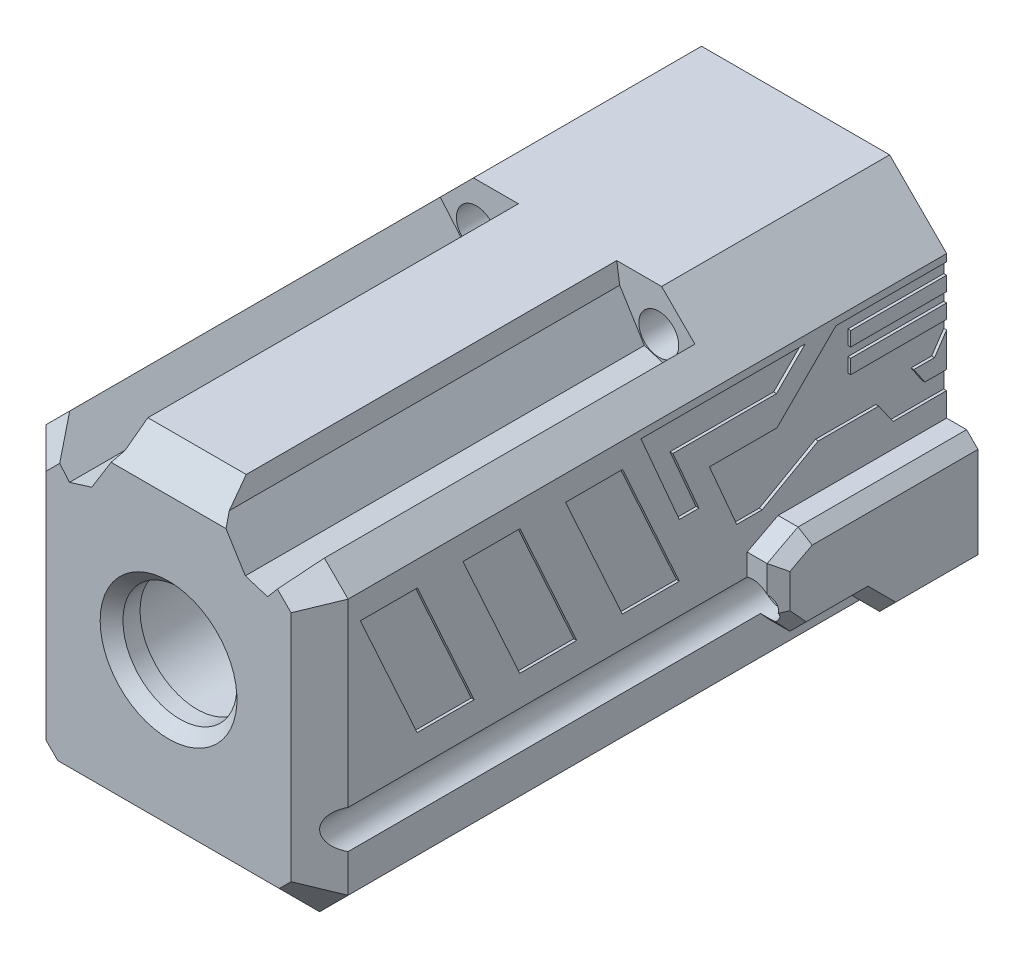
from build123d import *

# Parameters (mm, degrees)
EXTRUDE_1_DEPTH            = 26.5
CUT_EXTRUDE_1_DEPTH        = 20
CUT_EXTRUDE_4_DEPTH        = 22.6
SKETCH_7_W                 = 9.3
SKETCH_7_H                 = 6.5
EXTRUDE_2_DEPTH            = 23
CHAMFER_1_SIZE             = 2.5
CHAMFER_2_SIZE             = 10
SKETCH_8_R                 = 3.025
CUT_EXTRUDE_5_DEPTH        = 6
CHAMFER_3_SIZE             = 5
EXTRUDE_3_DEPTH            = 20
SKETCH_10_R                = 11.1
CUT_EXTRUDE_6_DEPTH        = 85
SKETCH_3_R                 = 10
CUT_EXTRUDE_7_DEPTH        = 129.071269221
CHAMFER_4_SIZE             = 2
EXTRUDE_4_DEPTH            = 5.5
CHAMFER_5_SIZE             = 2
CHAMFER_5_OF_MIRROR_1_SIZE = 2
SKETCH_14_R                = 1.95
CUT_EXTRUDE_8_DEPTH        = 130.321305283
SKETCH_15_R                = 3.5
CUT_EXTRUDE_9_DEPTH        = 80
CHAMFER_6_SIZE             = 5
CUT_EXTRUDE_10_DEPTH       = 70
CUT_EXTRUDE_11_REACH       = 131.321
CUT_EXTRUDE_11_END_RADIUS  = 11.1
SKETCH_17_R                = 1.925
SKETCH_18_R                = 3.5
CUT_EXTRUDE_12_DEPTH       = 4
CUT_EXTRUDE_13_DEPTH       = 0.5
CHAMFER_7_SIZE             = 0.3


with BuildPart() as part:
    # 스케치1 → 보스-돌출1 (new, symmetric)
    with BuildSketch(Plane(origin=(0, 0, 0), x_dir=(0, 0, -1), z_dir=(1, 0, 0))):
        Polygon((0, 0), (0, -55), (-24.02707612, -55), (-26.365643229, -60), (-110, -60), (-110, 0), align=None)
    extrude(amount=EXTRUDE_1_DEPTH, both=True)

    # 스케치2 → 컷-돌출1 (cut)
    with BuildSketch(Plane.XY):
        with BuildLine():
            Line((22.575, -30), (22.575, -55))
            Line((22.575, -55), (-22.575, -55))
            Line((-22.575, -55), (-22.575, -30))
            ThreePointArc((-22.575, -30), (0, -7.425), (22.575, -30))
        make_face()
    extrude(amount=CUT_EXTRUDE_1_DEPTH, mode=Mode.SUBTRACT)

    # 스케치6 → 컷-돌출4 (cut, symmetric)
    with BuildSketch(Plane(origin=(0, 0, 0), x_dir=(0, 0, -1), z_dir=(1, 0, 0))):
        Polygon((-20, -46.112161055), (-23.199788804, -55), (-20, -55), align=None)
    extrude(amount=CUT_EXTRUDE_4_DEPTH, both=True, mode=Mode.SUBTRACT)

    # 스케치7 → 보스-돌출2 (add, symmetric)
    with BuildSketch(Plane(origin=(0, 0, 0), x_dir=(0, 0, -1), z_dir=(1, 0, 0))):
        with Locations((-15.35, -43.25)):
            Rectangle(SKETCH_7_W, SKETCH_7_H)
    extrude(amount=EXTRUDE_2_DEPTH, both=True)

    # 모따기1
    chamfer_1_edges = [part.edges().sort_by_distance(p)[0] for p in [
        (0, -46.5, 10.7),
        (0, -40, 10.7),
    ]]
    chamfer(chamfer_1_edges, length=CHAMFER_1_SIZE)

    # 모따기2
    chamfer_2_edges = [part.edges().sort_by_distance(p)[0] for p in [
        (26.5, 0, 55),
        (-26.5, 0, 55),
    ]]
    chamfer(chamfer_2_edges, length=CHAMFER_2_SIZE)

    # 스케치8 → 컷-돌출5 (cut)
    with BuildSketch(Plane(origin=(0, 1.083216677, 3.008778377), x_dir=(-1, 0, 0), z_dir=(0, -0.3387350985507473, -0.9408817848219911))):
        with Locations(Location((-17, -55.4, 0), (0, 0, 90))):
            Circle(SKETCH_8_R)
        with Locations(Location((17, -55.4, 0), (0, 0, 90))):
            Circle(SKETCH_8_R)
    extrude(amount=-CUT_EXTRUDE_5_DEPTH, mode=Mode.SUBTRACT)

    # 모따기3
    chamfer_3_edges = [part.edges().sort_by_distance(p)[0] for p in [
        (26.5, -60, 68.182821615),
        (-26.5, -60, 68.182821615),
    ]]
    chamfer(chamfer_3_edges, length=CHAMFER_3_SIZE)

    # 스케치9 → 보스-돌출3 (add, symmetric)
    with BuildSketch(Plane(origin=(0, 0, 0), x_dir=(0, 0, -1), z_dir=(1, 0, 0))):
        Polygon((-10.7, -7.425), (-10.7, -9.425), (-10.7, -18.425), (-20, -18.425), (-20, -7.425), align=None)
    extrude(amount=EXTRUDE_3_DEPTH, both=True)

    # 스케치10 → 컷-돌출6 (cut, symmetric)
    with BuildSketch(Plane(origin=(0, 0, 20), x_dir=(-1, 0, 0), z_dir=(0, 0, -1))):
        with Locations((0, -30)):
            Circle(SKETCH_10_R)
    extrude(amount=CUT_EXTRUDE_6_DEPTH, both=True, mode=Mode.SUBTRACT)

    # 스케치3 → 컷-돌출7 (cut, through all)
    with BuildSketch(Plane.XY.offset(110)):
        with Locations((0, -30)):
            Circle(SKETCH_3_R)
    extrude(amount=-CUT_EXTRUDE_7_DEPTH, mode=Mode.SUBTRACT)

    # 모따기4
    chamfer_4_edges = [part.edges().sort_by_distance(p)[0] for p in [
        (-10, -30, 110),
    ]]
    chamfer(chamfer_4_edges, length=CHAMFER_4_SIZE)

    # 스케치11 → 보스-돌출4 (add)
    with BuildSketch(Plane.ZY.offset(26.5)):
        Polygon((0, -55), (15.255568719, -55), (20.129912282, -50.125656437), (31.014597135, -50.125656437), (35, -45.790083075), (35, -37.843222592), (29.574281203, -35), (0, -35), align=None)
    extrude_4 = extrude(amount=EXTRUDE_4_DEPTH)

    # 모따기5
    chamfer_5_edges = [part.edges().sort_by_distance(p)[0] for p in [
        (-32, -55, 7.627784359),
        (-32, -52.562828218, 17.692740501),
        (-32, -50.125656437, 25.572254709),
        (-32, -47.957869756, 33.007298568),
        (-32, -41.816652834, 35),
        (-32, -36.421611296, 32.287140601),
        (-32, -35, 14.787140601),
    ]]
    chamfer(chamfer_5_edges, length=CHAMFER_5_SIZE)

    # 대칭 복사1: 보스-돌출4 across plane
    add(extrude_4.mirror(Plane(origin=(0, 0, 0), x_dir=(0, 0, 1), z_dir=(1, 0, 0))))

    # 모따기5 of 대칭 복사1
    chamfer_5_of_mirror_1_edges = [part.edges().sort_by_distance(p)[0] for p in [
        (32, -55, 7.627784359),
        (32, -52.562828218, 17.692740501),
        (32, -50.125656437, 25.572254709),
        (32, -47.957869756, 33.007298568),
        (32, -41.816652834, 35),
        (32, -36.421611296, 32.287140601),
        (32, -35, 14.787140601),
    ]]
    chamfer(chamfer_5_of_mirror_1_edges, length=CHAMFER_5_OF_MIRROR_1_SIZE)

    # 스케치14 → 컷-돌출8 (cut, through all)
    with BuildSketch(Plane.XY.offset(110)):
        with Locations(Location((-27.5, -45, 0), (0, 0, 59.148114014))):
            Circle(SKETCH_14_R)
        with Locations((-16, -7.5)):
            Circle(SKETCH_14_R)
        with Locations(Location((27.5, -45, 0), (0, 0, 336.098168715))):
            Circle(SKETCH_14_R)
        with Locations(Location((16, -7.5, 0), (0, 0, 270))):
            Circle(SKETCH_14_R)
    extrude(amount=-CUT_EXTRUDE_8_DEPTH, mode=Mode.SUBTRACT)

    # 스케치15 → 컷-돌출9 (cut)
    with BuildSketch(Plane.XY.offset(110)):
        with Locations((-16, -7.5)):
            Circle(SKETCH_15_R)
        with Locations((16, -7.5)):
            Circle(SKETCH_15_R)
        with Locations((-27.5, -45)):
            Circle(SKETCH_15_R)
        with Locations((27.5, -45)):
            Circle(SKETCH_15_R)
    extrude(amount=-CUT_EXTRUDE_9_DEPTH, mode=Mode.SUBTRACT)

    # 모따기6
    # the kernel refuses this chamfer: 5 mm, written as the material it takes off along each edge
    with BuildSketch(Plane(origin=(-26.5, -67.85841494, 110), x_dir=(-0.027495876610586282, 0, -0.9996219169112968), z_dir=(0, 1, 0))) as chamfer_6_piece_1:
        Polygon((CHAMFER_6_SIZE * 0.999621916911, -CHAMFER_6_SIZE * 0.0274958766106), (-CHAMFER_6_SIZE * 0.0274958766106, -CHAMFER_6_SIZE * 0.999621916911), (0, 0), align=None)
    extrude(amount=32.362727913, mode=Mode.SUBTRACT)
    with BuildSketch(Plane(origin=(-35.592272399, -45.907727601, 110), x_dir=(0.7068394360706735, 0.7068394360706735, 0.027495876610587687), z_dir=(0.7071067811865476, -0.7071067811865476, 0))) as chamfer_6_piece_2:
        Polygon((CHAMFER_6_SIZE * 0.999621916911, -CHAMFER_6_SIZE * 0.0274958766106), (-CHAMFER_6_SIZE * 0.0274958766106, -CHAMFER_6_SIZE * 0.999621916911), (0, 0), align=None)
    extrude(amount=32.787897692, mode=Mode.SUBTRACT)
    with BuildSketch(Plane(origin=(-34.35841494, -60, 110), x_dir=(0, 0.9996219169112968, 0.0274958766105877), z_dir=(1, 0, 0))) as chamfer_6_piece_3:
        Polygon((CHAMFER_6_SIZE * 0.999621916911, -CHAMFER_6_SIZE * 0.0274958766106), (-CHAMFER_6_SIZE * 0.0274958766106, -CHAMFER_6_SIZE * 0.999621916911), (0, 0), align=None)
    extrude(amount=68.71682988, mode=Mode.SUBTRACT)
    with BuildSketch(Plane(origin=(35.592272399, -45.907727601, 110), x_dir=(-0.7068394360706735, 0.7068394360706735, 0.027495876610587687), z_dir=(-0.7071067811865476, -0.7071067811865476, 0))) as chamfer_6_piece_4:
        Polygon((CHAMFER_6_SIZE * 0.999621916911, CHAMFER_6_SIZE * 0.0274958766106), (-CHAMFER_6_SIZE * 0.0274958766106, CHAMFER_6_SIZE * 0.999621916911), (0, 0), align=None)
    extrude(amount=32.787897692, mode=Mode.SUBTRACT)
    with BuildSketch(Plane(origin=(26.5, -67.85841494, 110), x_dir=(0.027495876610586282, 0, -0.9996219169112968), z_dir=(0, 1, 0))) as chamfer_6_piece_5:
        Polygon((CHAMFER_6_SIZE * 0.999621916911, CHAMFER_6_SIZE * 0.0274958766106), (-CHAMFER_6_SIZE * 0.0274958766106, CHAMFER_6_SIZE * 0.999621916911), (0, 0), align=None)
    extrude(amount=32.362727913, mode=Mode.SUBTRACT)
    with BuildSketch(Plane(origin=(26.5, -54.504312974, 110), x_dir=(0.027495876610586282, 0, -0.9996219169112968), z_dir=(0, 1, 0))) as chamfer_6_piece_6:
        Polygon((CHAMFER_6_SIZE * 0.999621916911, CHAMFER_6_SIZE * 0.0274958766106), (-CHAMFER_6_SIZE * 0.0274958766106, CHAMFER_6_SIZE * 0.999621916911), (0, 0), align=None)
    extrude(amount=57.362727913, mode=Mode.SUBTRACT)
    with BuildSketch(Plane(origin=(7.407727601, 9.092272399, 110), x_dir=(0.01944252080601411, 0.01944252080601411, -0.9996219169112968), z_dir=(0.7071067811865476, -0.7071067811865476, 0))) as chamfer_6_piece_7:
        Polygon((CHAMFER_6_SIZE * 0.999621916911, -CHAMFER_6_SIZE * 0.0274958766106), (-CHAMFER_6_SIZE * 0.0274958766106, -CHAMFER_6_SIZE * 0.999621916911), (0, 0), align=None)
    extrude(amount=39.858965503, mode=Mode.SUBTRACT)
    with BuildSketch(Plane(origin=(-29.35841494, 0, 110), x_dir=(0, 0.027495876610586334, -0.9996219169112968), z_dir=(1, 0, 0))) as chamfer_6_piece_8:
        Polygon((CHAMFER_6_SIZE * 0.999621916911, -CHAMFER_6_SIZE * 0.0274958766106), (-CHAMFER_6_SIZE * 0.0274958766106, -CHAMFER_6_SIZE * 0.999621916911), (0, 0), align=None)
    extrude(amount=58.71682988, mode=Mode.SUBTRACT)
    with BuildSketch(Plane(origin=(-7.407727601, 9.092272399, 110), x_dir=(-0.01944252080601411, 0.01944252080601411, -0.9996219169112968), z_dir=(-0.7071067811865476, -0.7071067811865476, 0))) as chamfer_6_piece_9:
        Polygon((CHAMFER_6_SIZE * 0.999621916911, CHAMFER_6_SIZE * 0.0274958766106), (-CHAMFER_6_SIZE * 0.0274958766106, CHAMFER_6_SIZE * 0.999621916911), (0, 0), align=None)
    extrude(amount=39.858965503, mode=Mode.SUBTRACT)
    with BuildSketch(Plane(origin=(-26.5, -54.504312974, 110), x_dir=(-0.027495876610586282, 0, -0.9996219169112968), z_dir=(0, 1, 0))) as chamfer_6_piece_10:
        Polygon((CHAMFER_6_SIZE * 0.999621916911, -CHAMFER_6_SIZE * 0.0274958766106), (-CHAMFER_6_SIZE * 0.0274958766106, -CHAMFER_6_SIZE * 0.999621916911), (0, 0), align=None)
    extrude(amount=57.362727913, mode=Mode.SUBTRACT)

    # 스케치16 → 컷-돌출10 (cut)
    with BuildSketch(Plane.XY.offset(110)):
        Polygon((-9.144916672, -3.49083683), (-13.465395992, -10.478742131), (-17.377415928, -11.69900523), (-25.488576529, -2.116350891), (-25.488576529, 1.062635418), (-8.470515022, 1.062635418), align=None)
        Polygon((25.488576529, 1.062635418), (8.470515022, 1.062635418), (9.144916672, -3.49083683), (13.465395992, -10.478742131), (17.377415928, -11.69900523), (25.488576529, -2.116350891), align=None)
    extrude(amount=-CUT_EXTRUDE_10_DEPTH, mode=Mode.SUBTRACT)

    # 컷-돌출11: up to this cylinder (the profile starts outside it)
    cut_extrude_11_end = Plane(origin=(0, -30, 62.5), z_dir=(0, 0, -1)) * Cylinder(CUT_EXTRUDE_11_END_RADIUS, 330.842, mode=Mode.PRIVATE)
    # 스케치17 → 컷-돌출11 (cut, up to the surface)
    with BuildSketch(Plane.XZ.offset(60), mode=Mode.PRIVATE) as cut_extrude_11_sk1:
        with Locations(Location((0, 40, 0), (0, 0, 270))):
            Circle(SKETCH_17_R)
    cut_extrude_11_tool1 = extrude(cut_extrude_11_sk1.sketch, amount=-CUT_EXTRUDE_11_REACH, mode=Mode.PRIVATE) - cut_extrude_11_end
    add(cut_extrude_11_tool1.solids().sort_by_distance((0, -60, 40))[0], mode=Mode.SUBTRACT)
    # 스케치17 → 컷-돌출11 (cut, up to the surface)
    with BuildSketch(Plane.XZ.offset(60), mode=Mode.PRIVATE) as cut_extrude_11_sk2:
        with Locations(Location((0, 85, 0), (0, 0, 270))):
            Circle(SKETCH_17_R)
    cut_extrude_11_tool2 = extrude(cut_extrude_11_sk2.sketch, amount=-CUT_EXTRUDE_11_REACH, mode=Mode.PRIVATE) - cut_extrude_11_end
    add(cut_extrude_11_tool2.solids().sort_by_distance((0, -60, 85))[0], mode=Mode.SUBTRACT)

    # 스케치18 → 컷-돌출12 (cut)
    with BuildSketch(Plane.XZ.offset(60)):
        with Locations(Location((0, 40, 0), (0, 0, 270))):
            Circle(SKETCH_18_R)
        with Locations(Location((0, 85, 0), (0, 0, 270))):
            Circle(SKETCH_18_R)
    extrude(amount=-CUT_EXTRUDE_12_DEPTH, mode=Mode.SUBTRACT)

    # 스케치19 → 컷-돌출13 (cut)
    with BuildSketch(Plane.ZY.offset(26.5)):
        Polygon((0, -11.253065409), (19.422980352, -11.253065409), (29.766264071, -21.596349127), (41.620334901, -21.596349127), (36.816699721, -32.743246149), (32.370639848, -32.743246149), (22.53772393, -27.213002665), (11.920786456, -27.213002665), (9.405993495, -30.814725007), (0, -30.814725007), (0, -27.60874054), (3.812028378, -27.60874054), (5.756741282, -24.745370672), (2.1198488, -24.745370672), (0, -21.596349127), (0, -19.996852942), (16.832500656, -19.996852942), (16.832500656, -17.496852942), (0, -17.496852942), (0, -15.784615521), (16.832500656, -15.784615521), (16.832500656, -13.284615521), (0, -13.284615521), align=None)
        Polygon((56.852701369, -14.367808986), (46.891138402, -36.328090143), (56.891138402, -36.328090143), (66.852701369, -14.367808986), align=None)
        Polygon((74.852701369, -14.367808986), (64.891138402, -36.328090143), (74.891138402, -36.328090143), (84.852701369, -14.367808986), align=None)
        Polygon((92.852701369, -14.367808986), (82.891138402, -36.328090143), (92.891138402, -36.328090143), (102.852701369, -14.367808986), align=None)
        Polygon((24.815312592, -11.326817632), (29.840386368, -16.351891407), (48.028703349, -16.351891407), (43.458927016, -26.953772502), (46.896467964, -26.953772502), (53.632224373, -11.326817632), align=None)
    cut_extrude_13 = extrude(amount=-CUT_EXTRUDE_13_DEPTH, mode=Mode.SUBTRACT)

    # 대칭 복사2: 컷-돌출13 across plane
    add(cut_extrude_13.mirror(Plane(origin=(0, 0, 0), x_dir=(0, 0, 1), z_dir=(1, 0, 0))), mode=Mode.SUBTRACT)

    # 모따기7
    chamfer_7_edges = [part.edges().sort_by_distance(p)[0] for p in [
        (0, -18.425, 10.7),
    ]]
    chamfer(chamfer_7_edges, length=CHAMFER_7_SIZE)


solid = part.part
